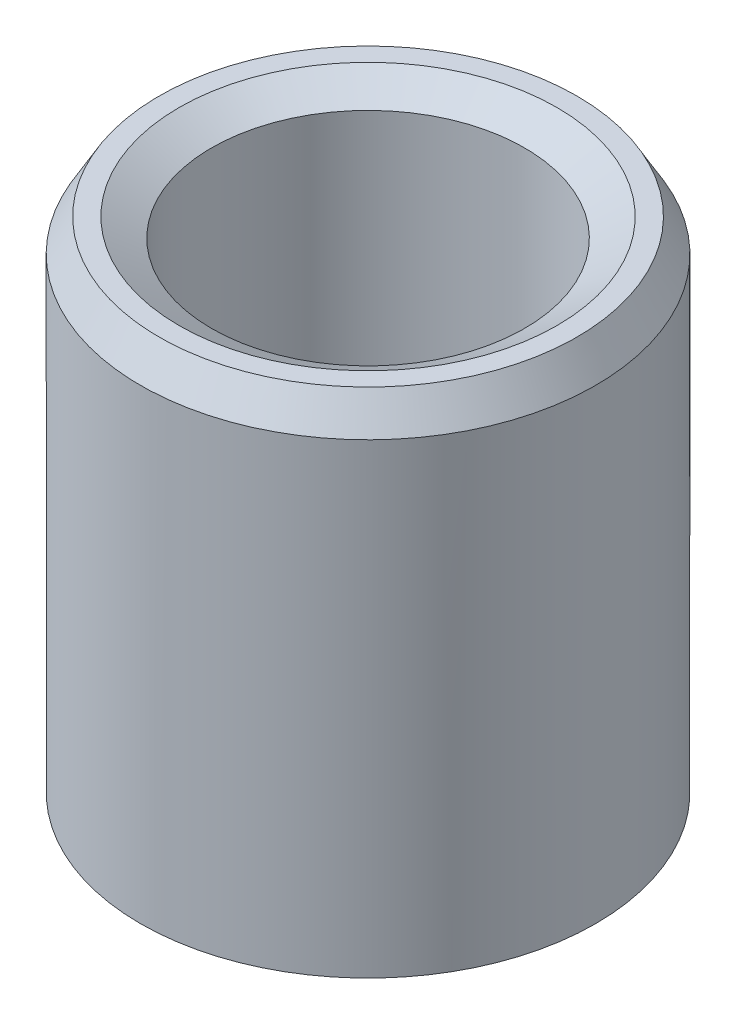
from build123d import *
from OCP.BRepFilletAPI import BRepFilletAPI_MakeChamfer

# Parameters (mm, degrees)
SKETCH1_R           = 20
BOSS_EXTRUDE1_DEPTH = 45.461129741
SKETCH2_R           = 13.751828192
CUT_EXTRUDE1_DEPTH  = 54.541706336
CHAMFER1_SIZE       = 2.849382698
CHAMFER1_SIZE2      = 1.645091868


with BuildPart() as part:
    # Sketch1 → Boss-Extrude1 (new body)
    with BuildSketch(Plane(origin=(0, 0, 0), x_dir=(1, 0, 0), z_dir=(0, 1, 0))):
        Circle(SKETCH1_R)
    extrude(amount=BOSS_EXTRUDE1_DEPTH)

    # Sketch2 → Cut-Extrude1 (cut, through all)
    with BuildSketch(Plane(origin=(0, 0, 0), x_dir=(1, 0, 0), z_dir=(0, 1, 0))):
        Circle(SKETCH2_R)
    extrude(amount=CUT_EXTRUDE1_DEPTH, mode=Mode.SUBTRACT)

    # Chamfer1: one chamfer whose edges measure the first distance from different faces: ONE call of the kernel's chamfer builder (chamfer() names one face for all edges)
    chamfer1_edges_1 = [part.edges().sort_by_distance(p)[0] for p in [
        (-13.751828192, 45.461129741, 0),
    ]]
    chamfer1_side_1 = [part.faces().sort_by_distance(p)[0] for p in [
        (-19.434314575, 45.461129741, 0),
    ]]
    chamfer1_edges_2 = [part.edges().sort_by_distance(p)[0] for p in [
        (-13.751828192, 0, 0),
    ]]
    chamfer1_side_2 = [part.faces().sort_by_distance(p)[0] for p in [
        (-13.751828192, 22.73056487, 0),
    ]]
    chamfer1_edges_3 = [part.edges().sort_by_distance(p)[0] for p in [
        (-20, 0, 0),
    ]]
    chamfer1_side_3 = [part.faces().sort_by_distance(p)[0] for p in [
        (-19.434314575, 0, 0),
    ]]
    chamfer1_edges_4 = [part.edges().sort_by_distance(p)[0] for p in [
        (-20, 45.461129741, 0),
    ]]
    chamfer1_side_4 = [part.faces().sort_by_distance(p)[0] for p in [
        (-20, 22.73056487, 0),
    ]]
    chamfer1 = BRepFilletAPI_MakeChamfer(part.part.solid().wrapped)
    for e in chamfer1_edges_1:
        chamfer1.Add(CHAMFER1_SIZE, CHAMFER1_SIZE2, e.wrapped, chamfer1_side_1[0].wrapped)  # the first distance lies on this face
    for e in chamfer1_edges_2:
        chamfer1.Add(CHAMFER1_SIZE, CHAMFER1_SIZE2, e.wrapped, chamfer1_side_2[0].wrapped)  # the first distance lies on this face
    for e in chamfer1_edges_3:
        chamfer1.Add(CHAMFER1_SIZE, CHAMFER1_SIZE2, e.wrapped, chamfer1_side_3[0].wrapped)  # the first distance lies on this face
    for e in chamfer1_edges_4:
        chamfer1.Add(CHAMFER1_SIZE, CHAMFER1_SIZE2, e.wrapped, chamfer1_side_4[0].wrapped)  # the first distance lies on this face
    add(Compound.cast(chamfer1.Shape()), mode=Mode.REPLACE)


solid = part.part
